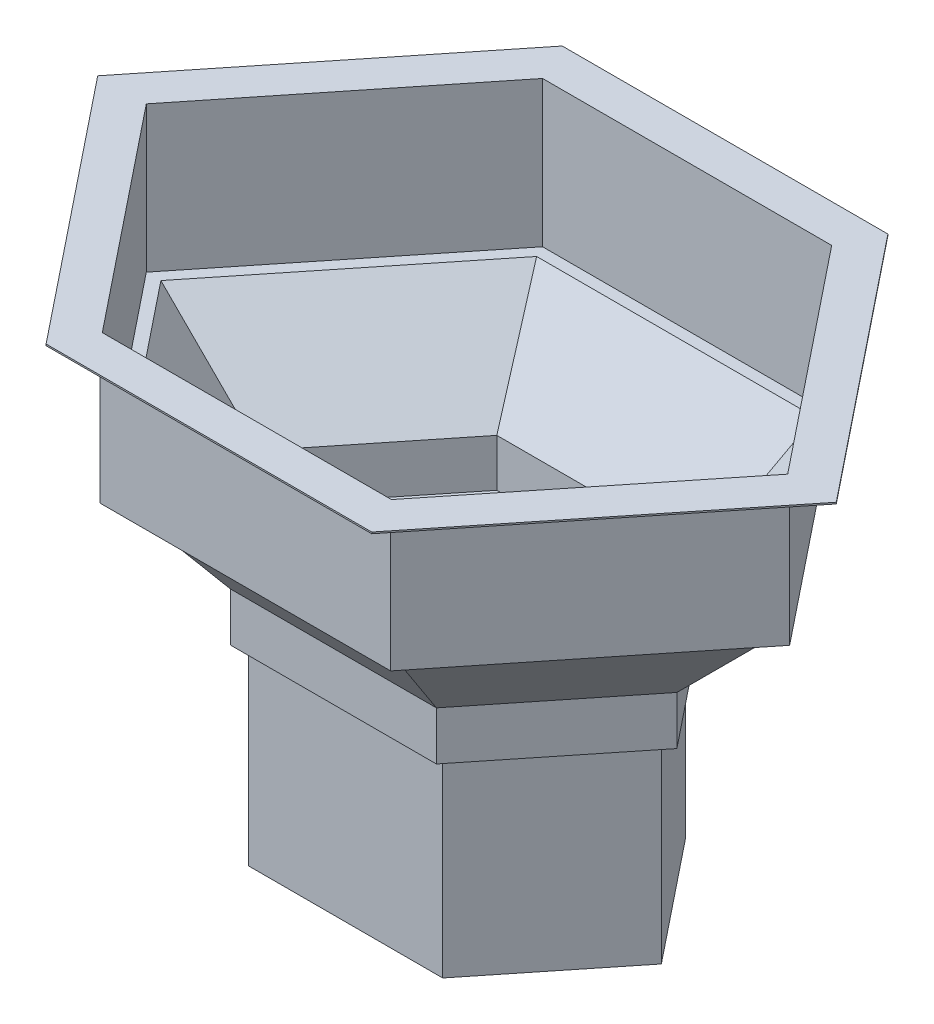
from build123d import *

# Parameters (mm, degrees)
BOSS_EXTRUDE1_DEPTH = 406.4
BOSS_EXTRUDE2_DEPTH = 101.6
BOSS_EXTRUDE3_DEPTH = 304.8
BOSS_EXTRUDE4_DEPTH = 3.175
SHELL3_START        = 3.175
SHELL3_DEPTH        = 1016
SHELL3_START_2      = 714.375
SHELL3_2_DEPTH      = 304.8
SHELL3_START_3      = 409.575
SHELL3_3_DEPTH      = 304.8


with BuildPart() as part:
    # Sketch2 → Boss-Extrude1 (new body)
    with BuildSketch(Plane(origin=(0, 0, 0), x_dir=(1, 0, 0), z_dir=(0, 1, 0))):
        Polygon((-203.2, 254), (-406.4, 0), (-203.2, -254), (203.2, -254), (406.4, 0), (203.2, 254), align=None)
    extrude(amount=BOSS_EXTRUDE1_DEPTH)

    # Sketch3 → Boss-Extrude2 (add)
    with BuildSketch(Plane(origin=(0, 406.4, 0), x_dir=(1, 0, 0), z_dir=(0, 1, 0))):
        Polygon((215.407871126, 279.4), (-215.407871126, 279.4), (-438.927871126, 0), (-215.407871126, -279.4), (215.407871126, -279.4), (438.927871126, 0), align=None)
    extrude(amount=BOSS_EXTRUDE2_DEPTH)

    # Sketch5 → Loft1 section 0
    with BuildSketch(Plane(origin=(0, 711.2, 0), x_dir=(1, 0, 0), z_dir=(0, 1, 0))):
        with BuildLine():
            Line((642.127871126, 0), (291.669837463, 438.072542079))
            Line((291.669837463, 438.072542079), (-291.669837463, 438.072542079))
            Line((-291.669837463, 438.072542079), (-642.127871126, 0))
            Line((-642.127871126, 0), (-291.669837463, -438.072542079))
            Line((-291.669837463, -438.072542079), (291.669837463, -438.072542079))
            Line((291.669837463, -438.072542079), (642.127871126, 0))
        make_face()
    # Sketch4 → Loft1 section 1
    with BuildSketch(Plane(origin=(0, 508, 0), x_dir=(1, 0, 0), z_dir=(0, 1, 0))):
        with BuildLine():
            Line((438.927871126, 0), (215.407871126, 279.4))
            Line((215.407871126, 279.4), (-215.407871126, 279.4))
            Line((-215.407871126, 279.4), (-438.927871126, 0))
            Line((-438.927871126, 0), (-215.407871126, -279.4))
            Line((-215.407871126, -279.4), (215.407871126, -279.4))
            Line((215.407871126, -279.4), (438.927871126, 0))
        make_face()
    loft()

    # Sketch6 → Boss-Extrude3 (add)
    with BuildSketch(Plane(origin=(0, 711.2, 0), x_dir=(1, 0, 0), z_dir=(0, 1, 0))):
        Polygon((303.877708589, -463.472542079), (674.655742252, 0), (303.877708589, 463.472542079), (-303.877708589, 463.472542079), (-674.655742252, 0), (-303.877708589, -463.472542079), align=None)
    extrude(amount=BOSS_EXTRUDE3_DEPTH)

    # Sketch7 → Boss-Extrude4 (add)
    with BuildSketch(Plane(origin=(0, 1016, 0), x_dir=(1, 0, 0), z_dir=(0, 1, 0))):
        Polygon((-340.501321968, -539.672542079), (340.501321968, -539.672542079), (772.239355631, 0), (340.501321968, 539.672542079), (-340.501321968, 539.672542079), (-772.239355631, 0), align=None)
    extrude(amount=BOSS_EXTRUDE4_DEPTH)

    # Shell3: read off the stored shape, not the designer's step
    # Shell3 outline → Shell3 (cut)
    with BuildSketch(Plane(origin=(0, 0, 0), x_dir=(1, 0, 0), z_dir=(0, 1, 0)).offset(SHELL3_START)):
        Polygon((201.674016109, 250.825), (-201.674016109, 250.825), (-402.334016109, 0), (-201.674016109, -250.825), (201.674016109, -250.825), (402.334016109, 0), align=None)
    extrude(amount=SHELL3_DEPTH, mode=Mode.SUBTRACT)

    # Shell3 2 outline → Shell3 2 (cut)
    with BuildSketch(Plane(origin=(0, 0, 0), x_dir=(1, 0, 0), z_dir=(0, 1, 0)).offset(SHELL3_START_2)):
        Polygon((-302.351724698, -460.297542079), (302.351724698, -460.297542079), (670.589758362, 0), (302.351724698, 460.297542079), (-302.351724698, 460.297542079), (-670.589758362, 0), align=None)
        Polygon((-402.334016109, 0), (-201.674016109, 250.825), (201.674016109, 250.825), (402.334016109, 0), (201.674016109, -250.825), (-201.674016109, -250.825), align=None, mode=Mode.SUBTRACT)
    extrude(amount=SHELL3_2_DEPTH, mode=Mode.SUBTRACT)

    # Shell3 3 outline → Shell3 3 (cut)
    with BuildSketch(Plane(origin=(0, 0, 0), x_dir=(1, 0, 0), z_dir=(0, 1, 0)).offset(SHELL3_START_3)):
        Polygon((434.861887235, 0), (213.881887235, 276.225), (-213.881887235, 276.225), (-434.861887235, 0), (-213.881887235, -276.225), (213.881887235, -276.225), align=None)
        Polygon((-402.334016109, 0), (-201.674016109, 250.825), (201.674016109, 250.825), (402.334016109, 0), (201.674016109, -250.825), (-201.674016109, -250.825), align=None, mode=Mode.SUBTRACT)
    extrude(amount=SHELL3_3_DEPTH, mode=Mode.SUBTRACT)

    # Shell3 4: loft between two sections, ruled curve by curve
    shell3_4_from = [
        Edge.make_line((-213.881887235, 509.092780496, -276.225), (-434.861887235, 509.092780496, 0)),
        Edge.make_line((-434.861887235, 509.092780496, 0), (-213.881887235, 509.092780496, 276.225)),
        Edge.make_line((213.881887235, 509.092780496, -276.225), (-213.881887235, 509.092780496, -276.225)),
        Edge.make_line((434.861887235, 509.092780496, 0), (213.881887235, 509.092780496, -276.225)),
        Edge.make_line((213.881887235, 509.092780496, 276.225), (434.861887235, 509.092780496, 0)),
        Edge.make_line((-213.881887235, 509.092780496, 276.225), (213.881887235, 509.092780496, 276.225)),
    ]
    shell3_4_to = [
        Edge.make_line((-290.925320864, 714.375, -436.523482344), (-640.144106739, 714.375, 0)),
        Edge.make_line((-640.144106739, 714.375, 0), (-290.925320864, 714.375, 436.523482344)),
        Edge.make_line((290.925320864, 714.375, -436.523482344), (-290.925320864, 714.375, -436.523482344)),
        Edge.make_line((640.144106739, 714.375, 0), (290.925320864, 714.375, -436.523482344)),
        Edge.make_line((290.925320864, 714.375, 436.523482344), (640.144106739, 714.375, 0)),
        Edge.make_line((-290.925320864, 714.375, 436.523482344), (290.925320864, 714.375, 436.523482344)),
    ]
    shell3_4 = Solid(Shell([*[Face.make_surface_from_curves(shell3_4_from[k], shell3_4_to[k]) for k in range(6)], Face(Wire(shell3_4_from)), Face(Wire(shell3_4_to))]))
    add(shell3_4, mode=Mode.SUBTRACT)


solid = part.part
